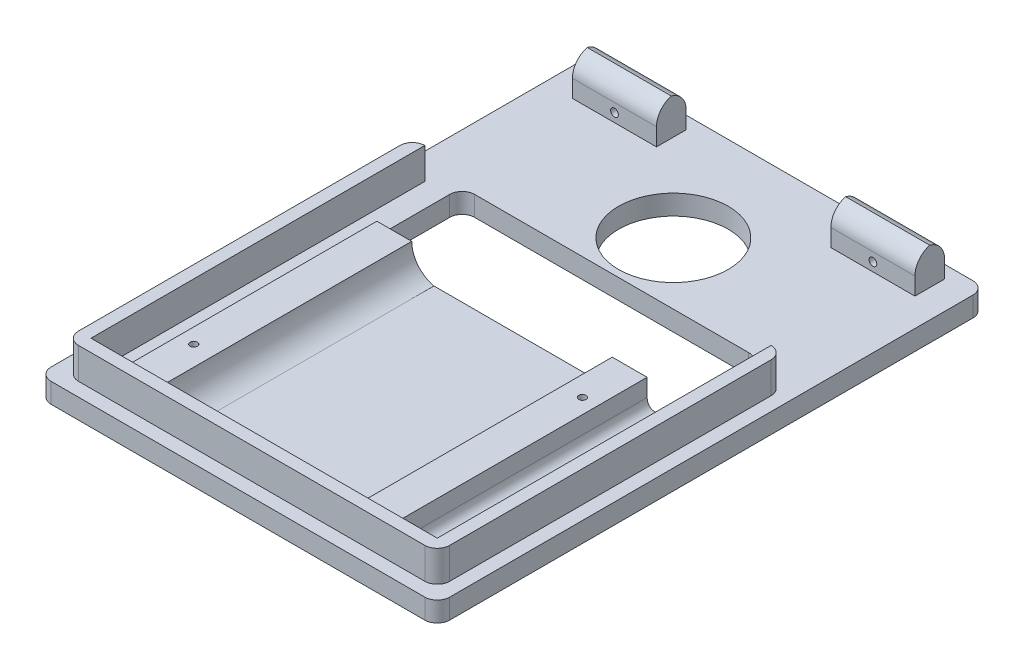
from build123d import *

# Parameters (mm, degrees)
BOSS_EXTRUDE1_DEPTH = 8
BOSS_EXTRUDE2_START = 8
SKETCH3_7_W         = 139.5
SKETCH3_7_H         = 11.9
BOSS_EXTRUDE2_DEPTH = 15
FILLET1_R           = 8
CUT_EXTRUDE1_REACH  = 139.901
BOSS_EXTRUDE3_DEPTH = 12.5
BOSS_EXTRUDE4_DEPTH = 99.5
CUT_EXTRUDE3_REACH  = 138.81
SKETCH9_W           = 70
SKETCH9_H           = 11.9
SKETCH9_W_2         = 1
CUT_EXTRUDE5_REACH  = 139.901
SKETCH11_R          = 22
FILLET2_R           = 4
CUT_EXTRUDE6_REACH  = 139.342
SKETCH12_R          = 1.45
SKETCH13_R          = 4
CUT_EXTRUDE7_DEPTH  = 4
CUT_EXTRUDE2_REACH  = 232.432
SKETCH6_R           = 1.55


with BuildPart() as part:
    # Sketch3 → Boss-Extrude1 (new body)
    with BuildSketch(Plane(origin=(0, 0, 0), x_dir=(1, 0, 0), z_dir=(0, 1, 0))):
        with BuildLine():
            Line((-75, 110), (75, 110))
            ThreePointArc((75, 110), (78.535533906, 108.535533906), (80, 105))
            Line((80, 105), (80, -105))
            ThreePointArc((80, -105), (78.535533906, -108.535533906), (75, -110))
            Line((75, -110), (-75, -110))
            ThreePointArc((-75, -110), (-78.535533906, -108.535533906), (-80, -105))
            Line((-80, -105), (-80, 105))
            ThreePointArc((-80, 105), (-78.535533906, 108.535533906), (-75, 110))
        make_face()
    extrude(amount=BOSS_EXTRUDE1_DEPTH)

    # Sketch3<7> → Boss-Extrude2 (add)
    with BuildSketch(Plane(origin=(0, 0, 0), x_dir=(1, 0, 0), z_dir=(0, 1, 0)).offset(BOSS_EXTRUDE2_START)):
        with Locations((0, 98.95)):
            Rectangle(SKETCH3_7_W, SKETCH3_7_H)
    extrude(amount=BOSS_EXTRUDE2_DEPTH)

    # Fillet1
    # the kernel refuses this fillet: 8 mm, written as the material it takes off along each edge
    with BuildSketch(Plane(origin=(89.75, 23, -93), x_dir=(0, -1, 0), z_dir=(-1, 0, 0)), Plane(origin=(-89.75, 23, -104.9), x_dir=(0, -1, 0), z_dir=(1, 0, 0))) as fillet1_piece_1:
        with BuildLine():
            CenterArc((FILLET1_R, -FILLET1_R), FILLET1_R, 90, 90)
            Line((0, -FILLET1_R), (0, 0))
            Line((0, 0), (FILLET1_R, 0))
        make_face()
    extrude(amount=179.5, mode=Mode.SUBTRACT)

    # Sketch4 → Cut-Extrude1 (cut, up to next)
    with BuildSketch(Plane.XZ, mode=Mode.PRIVATE) as cut_extrude1_sk1:
        with BuildLine():
            Line((-55, 0), (55, 0))
            ThreePointArc((55, 0), (58.535533906, -1.464466094), (60, -5))
            Line((60, -5), (60, -35))
            ThreePointArc((60, -35), (58.535533906, -38.535533906), (55, -40))
            Line((55, -40), (-55, -40))
            ThreePointArc((-55, -40), (-58.535533906, -38.535533906), (-60, -35))
            Line((-60, -35), (-60, -5))
            ThreePointArc((-60, -5), (-58.535533906, -1.464466094), (-55, 0))
        make_face()
    cut_extrude1_tool1 = extrude(cut_extrude1_sk1.sketch, amount=-CUT_EXTRUDE1_REACH, mode=Mode.PRIVATE) & part.part
    add(cut_extrude1_tool1.solids().sort_by_distance((0, 0, -20))[0], mode=Mode.SUBTRACT)

    # Sketch5 → Boss-Extrude3 (add)
    with BuildSketch(Plane(origin=(0, 8, 0), x_dir=(1, 0, 0), z_dir=(0, 1, 0))):
        with BuildLine():
            ThreePointArc((-69.5, -104.5), (-73.035533906, -103.035533906), (-74.5, -99.5))
            Line((-74.5, -99.5), (-74.5, 29.5))
            ThreePointArc((-74.5, 29.5), (-73.035533906, 33.035533906), (-69.5, 34.5))
            Line((-69.5, 34.5), (-69.5, -99.5))
            Line((-69.5, -99.5), (69.5, -99.5))
            Line((69.5, -99.5), (69.5, 34.5))
            ThreePointArc((69.5, 34.5), (73.035533906, 33.035533906), (74.5, 29.5))
            Line((74.5, 29.5), (74.5, -99.5))
            ThreePointArc((74.5, -99.5), (73.035533906, -103.035533906), (69.5, -104.5))
            Line((69.5, -104.5), (-69.5, -104.5))
        make_face()
    extrude(amount=BOSS_EXTRUDE3_DEPTH)

    # Sketch8 → Boss-Extrude4 (add)
    with BuildSketch(Plane(origin=(0, 0, 99.5), x_dir=(-1, 0, 0), z_dir=(0, 0, -1))):
        with BuildLine():
            ThreePointArc((-31.313789331, 8), (-37.73637637, 11.944397261), (-40.25, 19.05))
            Line((-40.25, 19.05), (-54.25, 19.05))
            Line((-54.25, 19.05), (-54.25, 4.75))
            Line((-54.25, 4.75), (-28.95, 4.75))
            ThreePointArc((-28.95, 4.75), (-33.770529017, 5.586995135), (-38.026756028, 8))
            Line((-38.026756028, 8), (-31.313789331, 8))
        make_face()
        with BuildLine():
            ThreePointArc((40.25, 19.05), (37.73637637, 11.944397261), (31.313789331, 8))
            Line((31.313789331, 8), (38.026756028, 8))
            ThreePointArc((38.026756028, 8), (33.770529017, 5.586995135), (28.95, 4.75))
            Line((28.95, 4.75), (54.25, 4.75))
            Line((54.25, 4.75), (54.25, 19.05))
            Line((54.25, 19.05), (40.25, 19.05))
        make_face()
    extrude(amount=BOSS_EXTRUDE4_DEPTH)

    # Sketch9 → Cut-Extrude3 (cut, up to next)
    with BuildSketch(Plane(origin=(0, 8, 0), x_dir=(1, 0, 0), z_dir=(0, 1, 0)), mode=Mode.PRIVATE) as cut_extrude3_sk1:
        with Locations((0, 98.95)):
            Rectangle(SKETCH9_W, SKETCH9_H)
    cut_extrude3_tool1 = extrude(cut_extrude3_sk1.sketch, amount=CUT_EXTRUDE3_REACH, mode=Mode.PRIVATE) & part.part
    # Sketch9 → Cut-Extrude3 (cut, up to next)
    with BuildSketch(Plane(origin=(0, 8, 0), x_dir=(1, 0, 0), z_dir=(0, 1, 0)), mode=Mode.PRIVATE) as cut_extrude3_sk2:
        with Locations((-69.25, 98.95)):
            Rectangle(SKETCH9_W_2, SKETCH9_H)
    cut_extrude3_tool2 = extrude(cut_extrude3_sk2.sketch, amount=CUT_EXTRUDE3_REACH, mode=Mode.PRIVATE) & part.part
    # Sketch9 → Cut-Extrude3 (cut, up to next)
    with BuildSketch(Plane(origin=(0, 8, 0), x_dir=(1, 0, 0), z_dir=(0, 1, 0)), mode=Mode.PRIVATE) as cut_extrude3_sk3:
        with Locations((69.25, 98.95)):
            Rectangle(SKETCH9_W_2, SKETCH9_H)
    cut_extrude3_tool3 = extrude(cut_extrude3_sk3.sketch, amount=CUT_EXTRUDE3_REACH, mode=Mode.PRIVATE) & part.part
    add(cut_extrude3_tool1.solids().sort_by_distance((0, 8, -98.95))[0], mode=Mode.SUBTRACT)
    add(cut_extrude3_tool2.solids().sort_by_distance((-69.25, 8, -98.95))[0], mode=Mode.SUBTRACT)
    add(cut_extrude3_tool3.solids().sort_by_distance((69.25, 8, -98.95))[0], mode=Mode.SUBTRACT)

    # Sketch11 → Cut-Extrude5 (cut, up to next)
    with BuildSketch(Plane.XZ, mode=Mode.PRIVATE) as cut_extrude5_sk1:
        with Locations(Location((0, -64.78, 0), (0, 0, 270))):
            Circle(SKETCH11_R)
    cut_extrude5_tool1 = extrude(cut_extrude5_sk1.sketch, amount=-CUT_EXTRUDE5_REACH, mode=Mode.PRIVATE) & part.part
    add(cut_extrude5_tool1.solids().sort_by_distance((0, 0, -64.78))[0], mode=Mode.SUBTRACT)

    # Fillet2
    fillet2_edges = [part.edges().sort_by_distance(p)[0] for p in [
        (54.25, 8, 49.75),
        (-54.25, 8, 49.75),
    ]]
    fillet(fillet2_edges, radius=FILLET2_R)

    # Sketch12 → Cut-Extrude6 (cut, up to next)
    with BuildSketch(Plane(origin=(0, 19.05, 0), x_dir=(1, 0, 0), z_dir=(0, 1, 0)), mode=Mode.PRIVATE) as cut_extrude6_sk1:
        with Locations(Location((48.25, -20, 0), (0, 0, 270))):
            Circle(SKETCH12_R)
    cut_extrude6_tool1 = extrude(cut_extrude6_sk1.sketch, amount=-CUT_EXTRUDE6_REACH, mode=Mode.PRIVATE) & part.part
    # Sketch12 → Cut-Extrude6 (cut, up to next)
    with BuildSketch(Plane(origin=(0, 19.05, 0), x_dir=(1, 0, 0), z_dir=(0, 1, 0)), mode=Mode.PRIVATE) as cut_extrude6_sk2:
        with Locations(Location((-48.25, -79.5, 0), (0, 0, 270))):
            Circle(SKETCH12_R)
    cut_extrude6_tool2 = extrude(cut_extrude6_sk2.sketch, amount=-CUT_EXTRUDE6_REACH, mode=Mode.PRIVATE) & part.part
    add(cut_extrude6_tool1.solids().sort_by_distance((48.25, 19.05, 20))[0], mode=Mode.SUBTRACT)
    add(cut_extrude6_tool2.solids().sort_by_distance((-48.25, 19.05, 79.5))[0], mode=Mode.SUBTRACT)

    # Sketch13 → Cut-Extrude7 (cut)
    with BuildSketch(Plane.XZ):
        with Locations(Location((-48.25, 79.5, 0), (0, 0, 270))):
            Circle(SKETCH13_R)
        with Locations(Location((48.25, 20, 0), (0, 0, 270))):
            Circle(SKETCH13_R)
    extrude(amount=-CUT_EXTRUDE7_DEPTH, mode=Mode.SUBTRACT)

    # Sketch6 → Cut-Extrude2 (cut, up to next)
    with BuildSketch(Plane(origin=(0, 0, -104.9), x_dir=(-1, 0, 0), z_dir=(0, 0, -1)), mode=Mode.PRIVATE) as cut_extrude2_sk1:
        with Locations((-51.875, 11.5)):
            Circle(SKETCH6_R)
    cut_extrude2_tool1 = extrude(cut_extrude2_sk1.sketch, amount=-CUT_EXTRUDE2_REACH, mode=Mode.PRIVATE) & part.part
    # Sketch6 → Cut-Extrude2 (cut, up to next)
    with BuildSketch(Plane(origin=(0, 0, -104.9), x_dir=(-1, 0, 0), z_dir=(0, 0, -1)), mode=Mode.PRIVATE) as cut_extrude2_sk2:
        with Locations(Location((51.875, 11.5, 0), (0, 0, 180))):
            Circle(SKETCH6_R)
    cut_extrude2_tool2 = extrude(cut_extrude2_sk2.sketch, amount=-CUT_EXTRUDE2_REACH, mode=Mode.PRIVATE) & part.part
    add(cut_extrude2_tool1.solids().sort_by_distance((51.875, 11.5, -104.9))[0], mode=Mode.SUBTRACT)
    add(cut_extrude2_tool2.solids().sort_by_distance((-51.875, 11.5, -104.9))[0], mode=Mode.SUBTRACT)


solid = part.part
